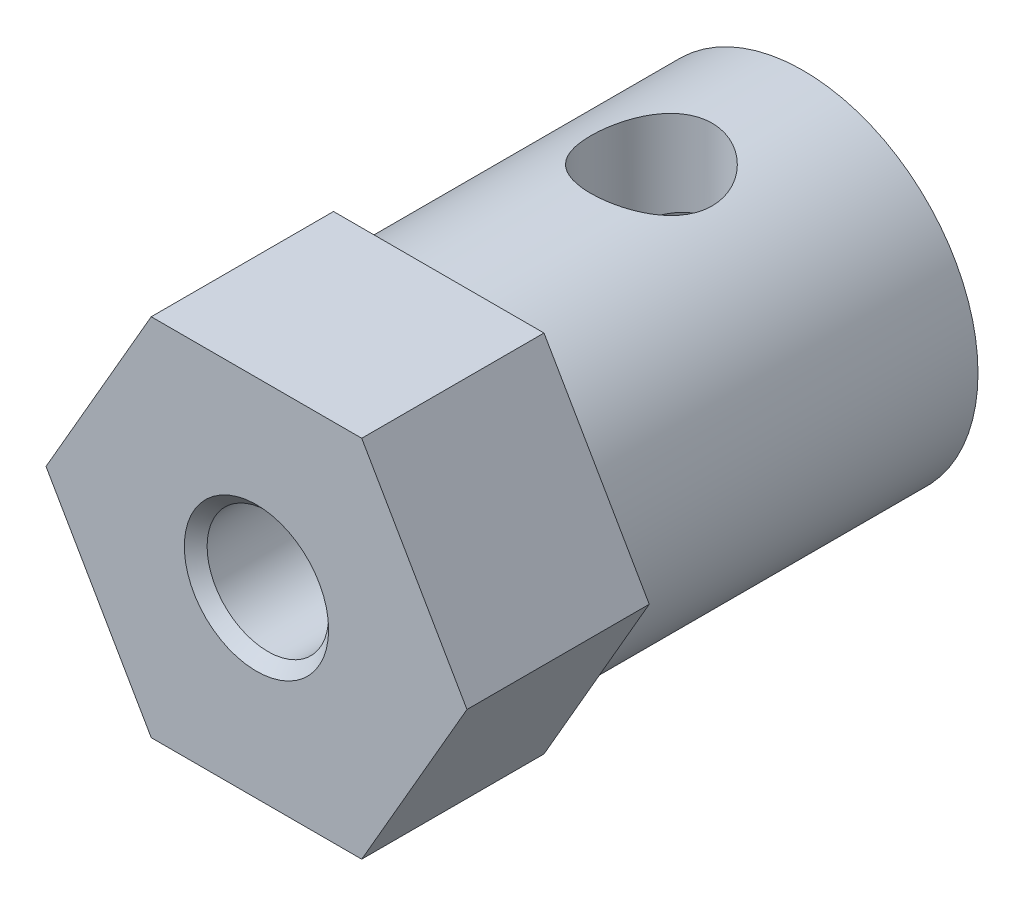
from build123d import *

# Parameters (mm, degrees)
EXTRUDE_1_DEPTH              = 6
SKETCH_2_W                   = 5.75
SKETCH_2_H                   = 12
HOLE_WIZARD_M4_1_D           = 4
HOLE_WIZARD_M4_1_CBORE_D     = 6
HOLE_WIZARD_M4_1_CBORE_DEPTH = 12
SKETCH_7_R                   = 2
CUT_EXTRUDE_1_DEPTH          = 19.167622299
CHAMFER_1_SIZE               = 0.375


with BuildPart() as part:
    # 草图1 → 凸台-拉伸1 (new body)
    with BuildSketch(Plane.XY.offset(6)):
        Polygon((-3.464101615, -6), (3.464101615, -6), (6.92820323, 0), (3.464101615, 6), (-3.464101615, 6), (-6.92820323, 0), align=None)
    extrude(amount=-EXTRUDE_1_DEPTH)

    # 草图2 → 旋转1 (revolve)
    with BuildSketch(Plane(origin=(0, 0, 0), x_dir=(1, 0, 0), z_dir=(0, 1, 0))):
        with Locations((2.875, 6)):
            Rectangle(SKETCH_2_W, SKETCH_2_H)
    revolve(axis=Axis((0, 0, -12), (0, 0, 1)))

    # M4 六角头机械螺钉的柱形沉头孔1 (through all)
    with Locations(Plane(origin=(0, 0, -12), x_dir=(-1, 0, 0), z_dir=(0, 0, -1))):
        with Locations((0, 0)):
            CounterBoreHole(HOLE_WIZARD_M4_1_D / 2, HOLE_WIZARD_M4_1_CBORE_D / 2, HOLE_WIZARD_M4_1_CBORE_DEPTH)

    # 草图7 → 切除-拉伸1 (cut, through all)
    with BuildSketch(Plane(origin=(0, 5.75, 0), x_dir=(1, 0, 0), z_dir=(0, 1, 0))):
        with Locations((0, 7)):
            Circle(SKETCH_7_R)
    extrude(amount=-CUT_EXTRUDE_1_DEPTH, mode=Mode.SUBTRACT)

    # 倒角1
    chamfer_1_edges = [part.edges().sort_by_distance(p)[0] for p in [
        (-2, 0, 6),
    ]]
    chamfer(chamfer_1_edges, length=CHAMFER_1_SIZE)


solid = part.part
